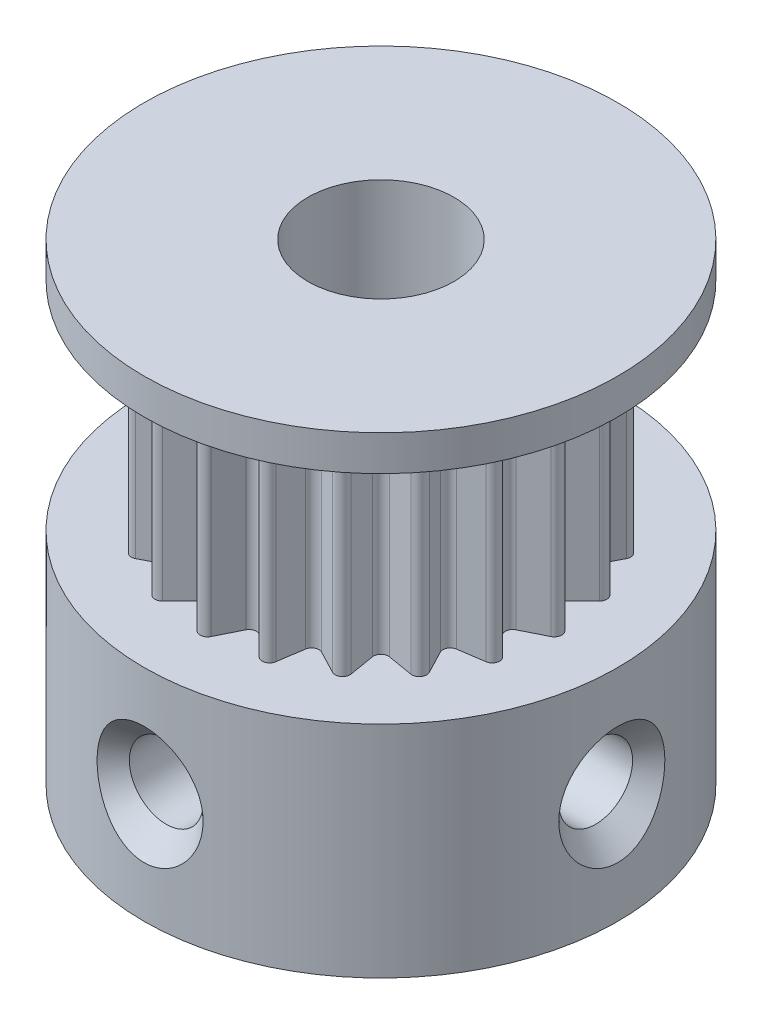
from build123d import *

# Parameters (mm, degrees)
SKETCH1_R           = 8.025
BOSS_EXTRUDE1_DEPTH = 16
CUT_EXTRUDE1_START  = -8.55
SKETCH2_R           = 8.025
CUT_EXTRUDE1_DEPTH  = 7.35
SKETCH3_R           = 2.475
CUT_EXTRUDE2_DEPTH  = 20.616351598
CIRPATTERN1_COUNT   = 2
CIRPATTERN1_ANGLE   = 90


# Read off the part's stored shape, not the designer's step: M3x0.5 Tapped Hole1
with BuildPart() as part:
    # Sketch1 → Boss-Extrude1 (new body)
    with BuildSketch(Plane(origin=(0, 0, 0), x_dir=(1, 0, 0), z_dir=(0, 1, 0))):
        with Locations(Location((0, 0, 0), (0, 0, 270))):
            Circle(SKETCH1_R)
    extrude(amount=BOSS_EXTRUDE1_DEPTH)

    # Sketch2 → Cut-Extrude1 (cut)
    with BuildSketch(Plane(origin=(0, 16, 0), x_dir=(1, 0, 0), z_dir=(0, 1, 0)).offset(CUT_EXTRUDE1_START)):
        with Locations(Location((0, 0, 0), (0, 0, 270))):
            Circle(SKETCH2_R)
        with BuildLine():
            Line((0.223750509, 5.986515514), (0.617084741, 5.197309317))
            ThreePointArc((0.617084741, 5.197309317), (0.801726633, 5.061902746), (1.01917444, 5.133624565))
            Line((1.01917444, 5.133624565), (1.637135651, 5.762657299))
            ThreePointArc((1.637135651, 5.762657299), (1.756034951, 5.830288043), (1.892729091, 5.825221162))
            ThreePointArc((1.892729091, 5.825221162), (2.00629521, 5.748973556), (2.06273441, 5.62437188))
            Line((2.06273441, 5.62437188), (2.192939368, 4.752245221))
            ThreePointArc((2.192939368, 4.752245221), (2.326701311, 4.566408436), (2.555669726, 4.567424872))
            Line((2.555669726, 4.567424872), (3.337767568, 4.974710037))
            ThreePointArc((3.337767568, 4.974710037), (3.471746571, 5.002288793), (3.60018467, 4.955229091))
            ThreePointArc((3.60018467, 4.955229091), (3.684630662, 4.847619447), (3.699803496, 4.711675538))
            Line((3.699803496, 4.711675538), (3.55413381, 3.841998252))
            ThreePointArc((3.55413381, 3.841998252), (3.623922254, 3.623922254), (3.841998252, 3.55413381))
            Line((3.841998252, 3.55413381), (4.711675538, 3.699803496))
            ThreePointArc((4.711675538, 3.699803496), (4.847619447, 3.684630662), (4.955229091, 3.60018467))
            ThreePointArc((4.955229091, 3.60018467), (5.002288793, 3.471746571), (4.974710037, 3.337767568))
            Line((4.974710037, 3.337767568), (4.567424872, 2.555669726))
            ThreePointArc((4.567424872, 2.555669726), (4.566408436, 2.326701311), (4.752245221, 2.192939368))
            Line((4.752245221, 2.192939368), (5.62437188, 2.06273441))
            ThreePointArc((5.62437188, 2.06273441), (5.748973556, 2.00629521), (5.825221162, 1.892729091))
            ThreePointArc((5.825221162, 1.892729091), (5.830288043, 1.756034951), (5.762657299, 1.637135651))
            Line((5.762657299, 1.637135651), (5.133624565, 1.01917444))
            ThreePointArc((5.133624565, 1.01917444), (5.061902746, 0.801726633), (5.197309317, 0.617084741))
            Line((5.197309317, 0.617084741), (5.986515514, 0.223750509))
            ThreePointArc((5.986515514, 0.223750509), (6.087578078, 0.131569604), (6.125, 0))
            ThreePointArc((6.125, 0), (6.087578078, -0.131569604), (5.986515514, -0.223750509))
            Line((5.986515514, -0.223750509), (5.197309317, -0.617084741))
            ThreePointArc((5.197309317, -0.617084741), (5.061902746, -0.801726633), (5.133624565, -1.01917444))
            Line((5.133624565, -1.01917444), (5.762657299, -1.637135651))
            ThreePointArc((5.762657299, -1.637135651), (5.830288043, -1.756034951), (5.825221162, -1.892729091))
            ThreePointArc((5.825221162, -1.892729091), (5.748973556, -2.00629521), (5.62437188, -2.06273441))
            Line((5.62437188, -2.06273441), (4.752245221, -2.192939368))
            ThreePointArc((4.752245221, -2.192939368), (4.566408436, -2.326701311), (4.567424872, -2.555669726))
            Line((4.567424872, -2.555669726), (4.974710037, -3.337767568))
            ThreePointArc((4.974710037, -3.337767568), (5.002288793, -3.471746571), (4.955229091, -3.60018467))
            ThreePointArc((4.955229091, -3.60018467), (4.847619447, -3.684630662), (4.711675538, -3.699803496))
            Line((4.711675538, -3.699803496), (3.841998252, -3.55413381))
            ThreePointArc((3.841998252, -3.55413381), (3.623922254, -3.623922254), (3.55413381, -3.841998252))
            Line((3.55413381, -3.841998252), (3.699803496, -4.711675538))
            ThreePointArc((3.699803496, -4.711675538), (3.684630662, -4.847619447), (3.60018467, -4.955229091))
            ThreePointArc((3.60018467, -4.955229091), (3.471746571, -5.002288793), (3.337767568, -4.974710037))
            Line((3.337767568, -4.974710037), (2.555669726, -4.567424872))
            ThreePointArc((2.555669726, -4.567424872), (2.326701311, -4.566408436), (2.192939368, -4.752245221))
            Line((2.192939368, -4.752245221), (2.06273441, -5.62437188))
            ThreePointArc((2.06273441, -5.62437188), (2.00629521, -5.748973556), (1.892729091, -5.825221162))
            ThreePointArc((1.892729091, -5.825221162), (1.756034951, -5.830288043), (1.637135651, -5.762657299))
            Line((1.637135651, -5.762657299), (1.01917444, -5.133624565))
            ThreePointArc((1.01917444, -5.133624565), (0.801726633, -5.061902746), (0.617084741, -5.197309317))
            Line((0.617084741, -5.197309317), (0.223750509, -5.986515514))
            ThreePointArc((0.223750509, -5.986515514), (0.131569604, -6.087578078), (0, -6.125))
            ThreePointArc((0, -6.125), (-0.131569604, -6.087578078), (-0.223750509, -5.986515514))
            Line((-0.223750509, -5.986515514), (-0.617084741, -5.197309317))
            ThreePointArc((-0.617084741, -5.197309317), (-0.801726633, -5.061902746), (-1.01917444, -5.133624565))
            Line((-1.01917444, -5.133624565), (-1.637135651, -5.762657299))
            ThreePointArc((-1.637135651, -5.762657299), (-1.756034951, -5.830288043), (-1.892729091, -5.825221162))
            ThreePointArc((-1.892729091, -5.825221162), (-2.00629521, -5.748973556), (-2.06273441, -5.62437188))
            Line((-2.06273441, -5.62437188), (-2.192939368, -4.752245221))
            ThreePointArc((-2.192939368, -4.752245221), (-2.326701311, -4.566408436), (-2.555669726, -4.567424872))
            Line((-2.555669726, -4.567424872), (-3.337767568, -4.974710037))
            ThreePointArc((-3.337767568, -4.974710037), (-3.471746571, -5.002288793), (-3.60018467, -4.955229091))
            ThreePointArc((-3.60018467, -4.955229091), (-3.684630662, -4.847619447), (-3.699803496, -4.711675538))
            Line((-3.699803496, -4.711675538), (-3.55413381, -3.841998252))
            ThreePointArc((-3.55413381, -3.841998252), (-3.623922254, -3.623922254), (-3.841998252, -3.55413381))
            Line((-3.841998252, -3.55413381), (-4.711675538, -3.699803496))
            ThreePointArc((-4.711675538, -3.699803496), (-4.847619447, -3.684630662), (-4.955229091, -3.60018467))
            ThreePointArc((-4.955229091, -3.60018467), (-5.002288793, -3.471746571), (-4.974710037, -3.337767568))
            Line((-4.974710037, -3.337767568), (-4.567424872, -2.555669726))
            ThreePointArc((-4.567424872, -2.555669726), (-4.566408436, -2.326701311), (-4.752245221, -2.192939368))
            Line((-4.752245221, -2.192939368), (-5.62437188, -2.06273441))
            ThreePointArc((-5.62437188, -2.06273441), (-5.748973556, -2.00629521), (-5.825221162, -1.892729091))
            ThreePointArc((-5.825221162, -1.892729091), (-5.830288043, -1.756034951), (-5.762657299, -1.637135651))
            Line((-5.762657299, -1.637135651), (-5.133624565, -1.01917444))
            ThreePointArc((-5.133624565, -1.01917444), (-5.061902746, -0.801726633), (-5.197309317, -0.617084741))
            Line((-5.197309317, -0.617084741), (-5.986515514, -0.223750509))
            ThreePointArc((-5.986515514, -0.223750509), (-6.087578078, -0.131569604), (-6.125, 0))
            ThreePointArc((-6.125, 0), (-6.087578078, 0.131569604), (-5.986515514, 0.223750509))
            Line((-5.986515514, 0.223750509), (-5.197309317, 0.617084741))
            ThreePointArc((-5.197309317, 0.617084741), (-5.061902746, 0.801726633), (-5.133624565, 1.01917444))
            Line((-5.133624565, 1.01917444), (-5.762657299, 1.637135651))
            ThreePointArc((-5.762657299, 1.637135651), (-5.830288043, 1.756034951), (-5.825221162, 1.892729091))
            ThreePointArc((-5.825221162, 1.892729091), (-5.748973556, 2.00629521), (-5.62437188, 2.06273441))
            Line((-5.62437188, 2.06273441), (-4.752245221, 2.192939368))
            ThreePointArc((-4.752245221, 2.192939368), (-4.566408436, 2.326701311), (-4.567424872, 2.555669726))
            Line((-4.567424872, 2.555669726), (-4.974710037, 3.337767568))
            ThreePointArc((-4.974710037, 3.337767568), (-5.002288793, 3.471746571), (-4.955229091, 3.60018467))
            ThreePointArc((-4.955229091, 3.60018467), (-4.847619447, 3.684630662), (-4.711675538, 3.699803496))
            Line((-4.711675538, 3.699803496), (-3.841998252, 3.55413381))
            ThreePointArc((-3.841998252, 3.55413381), (-3.623922254, 3.623922254), (-3.55413381, 3.841998252))
            Line((-3.55413381, 3.841998252), (-3.699803496, 4.711675538))
            ThreePointArc((-3.699803496, 4.711675538), (-3.684630662, 4.847619447), (-3.60018467, 4.955229091))
            ThreePointArc((-3.60018467, 4.955229091), (-3.471746571, 5.002288793), (-3.337767568, 4.974710037))
            Line((-3.337767568, 4.974710037), (-2.555669726, 4.567424872))
            ThreePointArc((-2.555669726, 4.567424872), (-2.326701311, 4.566408436), (-2.192939368, 4.752245221))
            Line((-2.192939368, 4.752245221), (-2.06273441, 5.62437188))
            ThreePointArc((-2.06273441, 5.62437188), (-2.00629521, 5.748973556), (-1.892729091, 5.825221162))
            ThreePointArc((-1.892729091, 5.825221162), (-1.756034951, 5.830288043), (-1.637135651, 5.762657299))
            Line((-1.637135651, 5.762657299), (-1.01917444, 5.133624565))
            ThreePointArc((-1.01917444, 5.133624565), (-0.801726633, 5.061902746), (-0.617084741, 5.197309317))
            Line((-0.617084741, 5.197309317), (-0.223750509, 5.986515514))
            ThreePointArc((-0.223750509, 5.986515514), (-0.131569604, 6.087578078), (0, 6.125))
            ThreePointArc((0, 6.125), (0.131569604, 6.087578078), (0.223750509, 5.986515514))
        make_face(mode=Mode.SUBTRACT)
    extrude(amount=CUT_EXTRUDE1_DEPTH, mode=Mode.SUBTRACT)

    # Sketch3 → Cut-Extrude2 (cut, through all)
    with BuildSketch(Plane(origin=(0, 16, 0), x_dir=(1, 0, 0), z_dir=(0, 1, 0))):
        with Locations(Location((0, 0, 0), (0, 0, 270))):
            Circle(SKETCH3_R)
    extrude(amount=-CUT_EXTRUDE2_DEPTH, mode=Mode.SUBTRACT)

    # M3x0.5 Tapped Hole1 outline → M3x0.5 Tapped Hole1 (revolve, cut)
    with BuildSketch(Plane.XZ.offset(-3.725)):
        Polygon((2.000000319, 8.025000319), (0, 8.025000319), (0, 2.135986764), (1.25, 2.135986764), (1.25, 7.275), align=None)
    m3x0_5_tapped_hole1 = revolve(axis=Axis((0, 3.725, 0), (0, 0, 1)), mode=Mode.SUBTRACT)

    # CirPattern1: M3x0.5 Tapped Hole1 ×2 about axis
    cirpattern1_axis = Axis((0, 16, 0), (0, 1, 0))
    for i in range(1, CIRPATTERN1_COUNT):
        add(m3x0_5_tapped_hole1.rotate(cirpattern1_axis, i * CIRPATTERN1_ANGLE / (CIRPATTERN1_COUNT - 1)), mode=Mode.SUBTRACT)


solid = part.part
